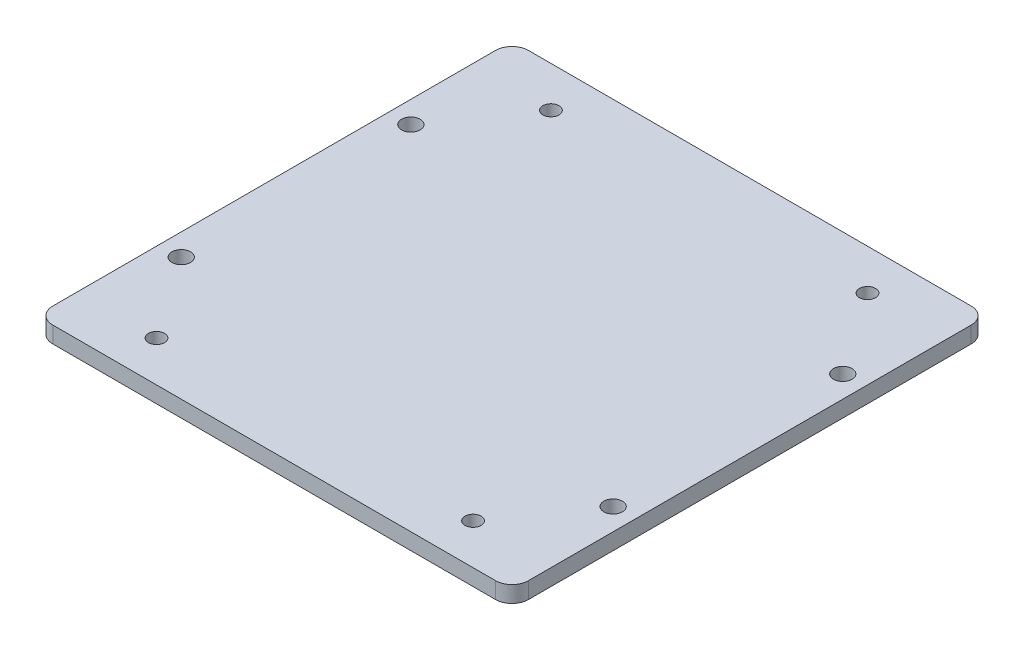
from build123d import *

# Parameters (mm, degrees)
SKETCH1_R           = 1.475
SKETCH1_R_2         = 1.7
BOSS_EXTRUDE1_DEPTH = 3


with BuildPart() as part:
    # Sketch1 → Boss-Extrude1 (new body)
    with BuildSketch(Plane(origin=(0, 0, 0), x_dir=(1, 0, 0), z_dir=(0, 1, 0))):
        with BuildLine():
            Line((-40.5, 43.5), (40.5, 43.5))
            ThreePointArc((40.5, 43.5), (42.621320344, 42.621320344), (43.5, 40.5))
            Line((43.5, 40.5), (43.5, -40.5))
            ThreePointArc((43.5, -40.5), (42.621320344, -42.621320344), (40.5, -43.5))
            Line((40.5, -43.5), (-40.5, -43.5))
            ThreePointArc((-40.5, -43.5), (-42.621320344, -42.621320344), (-43.5, -40.5))
            Line((-43.5, -40.5), (-43.5, 40.5))
            ThreePointArc((-43.5, 40.5), (-42.621320344, 42.621320344), (-40.5, 43.5))
        make_face()
        with Locations((28.95, -36.07)):
            Circle(SKETCH1_R, mode=Mode.SUBTRACT)
        with Locations((28.95, 36.07)):
            Circle(SKETCH1_R, mode=Mode.SUBTRACT)
        with Locations((-28.95, 36.07)):
            Circle(SKETCH1_R, mode=Mode.SUBTRACT)
        with Locations((-28.95, -36.07)):
            Circle(SKETCH1_R, mode=Mode.SUBTRACT)
        with Locations((39.5, 21)):
            Circle(SKETCH1_R_2, mode=Mode.SUBTRACT)
        with Locations((-39.5, 21)):
            Circle(SKETCH1_R_2, mode=Mode.SUBTRACT)
        with Locations((39.5, -21)):
            Circle(SKETCH1_R_2, mode=Mode.SUBTRACT)
        with Locations((-39.5, -21)):
            Circle(SKETCH1_R_2, mode=Mode.SUBTRACT)
    extrude(amount=BOSS_EXTRUDE1_DEPTH)


solid = part.part
